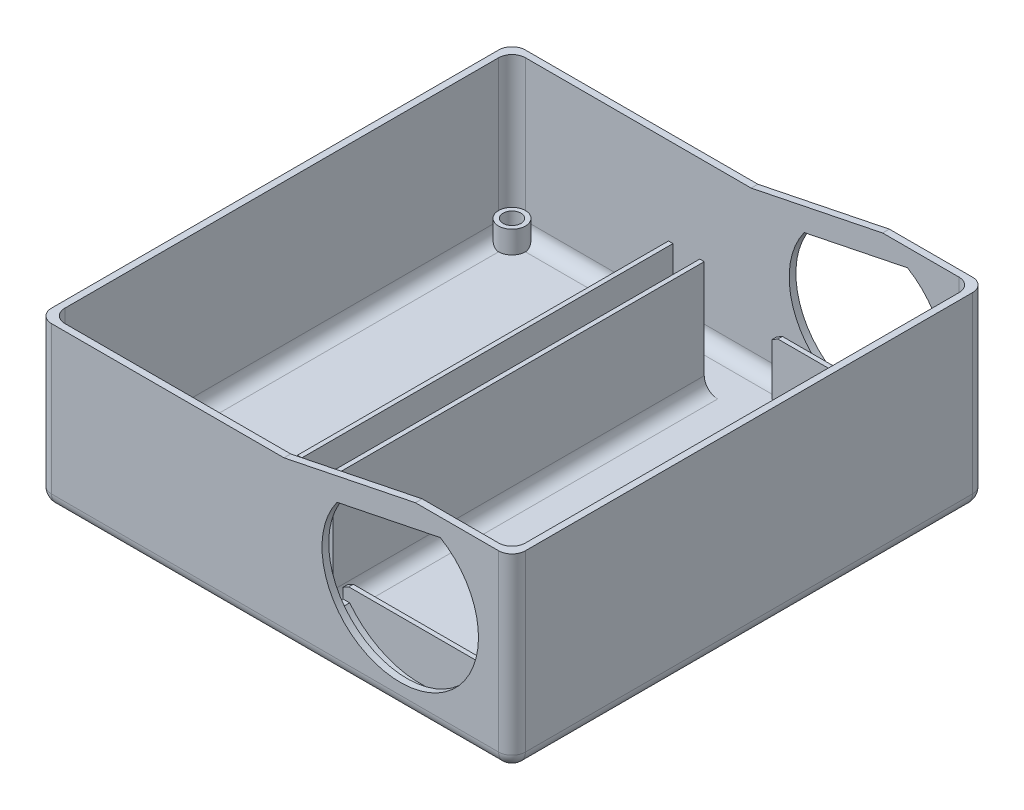
from build123d import *

# Parameters (mm, degrees)
EXTRUDE_1_DEPTH      = 42
SHELL_1_T            = -1.5
EXTRUDE_4_DEPTH      = 25
FILLET_2_R           = 3
CUT_EXTRUDE_3_DEPTH  = 126.73384588089242
CUT_EXTRUDE_4_DEPTH  = 126.73384588089242
EXTRUDE_5_DEPTH      = 4
CUT_EXTRUDE_7_DEPTH  = 3
CUT_EXTRUDE_START    = -0.1
CUT_EXTRUDE_12_DEPTH = 0.1
SKETCH_18_R          = 3.0000000000000018
SKETCH_18_R_2        = 2.0000000000000036
EXTRUDE_6_DEPTH      = 5
FILLET_3_R           = 3
SKETCH_22_W          = 3
SKETCH_22_H          = 3.000000000000014
CUT_EXTRUDE_13_DEPTH = 3
SKETCH_23_W          = 3.000000000000007
SKETCH_23_H          = 3.000000000000014
CUT_EXTRUDE_14_DEPTH = 3
FILLET_4_R           = 3


with BuildPart() as part:
    # 草图1 → 凸台-拉伸1 (new body)
    with BuildSketch(Plane(origin=(0, 0, 0), x_dir=(1, 0, 0), z_dir=(0, 1, 0))):
        Polygon((-53.000000000000014, 53), (52.999999999999986, 53), (53, -53), (-53, -53), align=None)
    extrude(amount=EXTRUDE_1_DEPTH)

    # 抽壳1
    shell_1_openings = [part.faces().sort_by_distance(p)[0] for p in [
        (0, 42, 0),
    ]]
    offset(amount=SHELL_1_T, openings=shell_1_openings, kind=Kind.INTERSECTION)

    # 草图3 → 凸台-拉伸4 (add)
    with BuildSketch(Plane(origin=(0, 1.5, 0), x_dir=(1, 0, 0), z_dir=(0, 1, 0))):
        Polygon((-6.500000000000012, 41.49999999999999), (-6.500000000000003, -41.49999999999999), (-5.500000000000003, -41.49999999999999), (-5.5000000000000036, 41.49999999999999), align=None)
        Polygon((1.4999999999999944, 41.49999999999999), (1.5000000000000053, -41.49999999999999), (0.5000000000000043, -41.49999999999999), (0.4999999999999944, 41.49999999999999), align=None)
    extrude(amount=EXTRUDE_4_DEPTH)

    # 圆角2
    fillet_2_edges = [part.edges().sort_by_distance(p)[0] for p in [
        (51.5, 21.75, 51.5),
        (51.499999999999986, 21.75, -51.5),
        (-51.500000000000014, 21.75, -51.5),
        (-51.5, 21.75, 51.5),
        (0, 0, 53),
        (-53.00000000000001, 0, 0),
        (-1.421e-14, 0, -53),
        (52.99999999999999, 0, 0),
        (53, 21, 53),
        (-53, 21, 53),
        (-53.000000000000014, 21, -53),
        (52.999999999999986, 21, -53),
    ]]
    fillet(fillet_2_edges, radius=FILLET_2_R)

    # 草图6 → 切除-拉伸3 (cut, through all)
    with BuildSketch(Plane.XY.offset(53)):
        Polygon((-53, 36.00000000000001), (2.0000000000000018, 36.00000000000001), (31.393876913398135, 42), (-53, 42), align=None)
    extrude(amount=-CUT_EXTRUDE_3_DEPTH, mode=Mode.SUBTRACT)

    # 草图7 → 切除-拉伸4 (cut, through all)
    with BuildSketch(Plane.XY.offset(53)):
        with BuildLine():
            Line((13.866100098640908, 33.319053909073325), (36.958961236370065, 38.032864449771985))
            ThreePointArc((36.958961236370065, 38.032864449771985), (31.499999999999993, 5.853571800517756), (13.866100098640908, 33.319053909073325))
        make_face()
    extrude(amount=-CUT_EXTRUDE_4_DEPTH, mode=Mode.SUBTRACT)

    # 草图8 → 凸台-拉伸5 (add)
    with BuildSketch(Plane(origin=(0, 0, 51.5), x_dir=(-1, 0, 0), z_dir=(0, 0, -1))):
        Polygon((-45.32050807568879, 13.00000000000003), (-44.021469970012134, 13.750000000000028), (-11.978530029987853, 13.750000000000032), (-10.679491924311197, 13.000000000000034), (-10.679491924311197, 1.5000000000000053), (-45.32050807568879, 1.5000000000000009), align=None)
    extrude_5 = extrude(amount=EXTRUDE_5_DEPTH)

    # 草图10 → 切除-拉伸7 (cut)
    with BuildSketch(Plane(origin=(0, 0, 51.5), x_dir=(-1, 0, 0), z_dir=(0, 0, -1))):
        with BuildLine():
            Line((-45.3205080756888, 13.000000000000043), (-27.999999999999996, 23))
            Line((-27.999999999999996, 23), (-10.679491924311197, 13.000000000000043))
            ThreePointArc((-10.679491924311197, 13.000000000000043), (-28, 2.9999999999999964), (-45.3205080756888, 13.000000000000043))
        make_face()
    cut_extrude_7 = extrude(amount=CUT_EXTRUDE_7_DEPTH, mode=Mode.SUBTRACT)

    # 镜向1: 凸台-拉伸5, 切除-拉伸7 across plane
    add(extrude_5.mirror(Plane.XY))
    add(cut_extrude_7.mirror(Plane.XY), mode=Mode.SUBTRACT)

    # 草图17 → 切除-拉伸12 (cut)
    with BuildSketch(Plane(origin=(0, 1.5, 0), x_dir=(1, 0, 0), z_dir=(0, 1, 0)).offset(CUT_EXTRUDE_START)):
        with BuildLine():
            Line((10.679491924311197, 47.5), (10.679491924311197, 51.5))
            Line((10.679491924311197, 51.5), (-48.50000000000001, 51.5))
            ThreePointArc((-48.50000000000001, 51.5), (-50.62132034355965, 50.62132034355964), (-51.500000000000014, 48.49999999999999))
            Line((-51.500000000000014, 48.49999999999999), (-51.5, -48.49999999999999))
            ThreePointArc((-51.5, -48.49999999999999), (-50.62132034355964, -50.62132034355964), (-48.49999999999999, -51.5))
            Line((-48.49999999999999, -51.5), (10.679491924311197, -51.5))
            Line((10.679491924311197, -51.5), (10.679491924311197, -47.5))
            Line((10.679491924311197, -47.5), (45.32050807568879, -47.5))
            Line((45.32050807568879, -47.5), (45.32050807568879, -51.5))
            Line((45.32050807568879, -51.5), (48.49999999999999, -51.5))
            ThreePointArc((48.49999999999999, -51.5), (50.62132034355964, -50.62132034355964), (51.5, -48.49999999999999))
            Line((51.5, -48.49999999999999), (51.499999999999986, 48.49999999999999))
            ThreePointArc((51.499999999999986, 48.49999999999999), (50.621320343559624, 50.62132034355964), (48.49999999999998, 51.5))
            Line((48.49999999999998, 51.5), (45.32050807568879, 51.5))
            Line((45.32050807568879, 51.5), (45.32050807568879, 47.5))
            Line((45.32050807568879, 47.5), (10.679491924311197, 47.5))
        make_face()
        Polygon((1.4999999999999944, 41.49999999999999), (0.4999999999999944, 41.49999999999999), (0.5000000000000043, -41.49999999999999), (1.5000000000000053, -41.49999999999999), align=None, mode=Mode.SUBTRACT)
        Polygon((-5.5000000000000036, 41.49999999999999), (-6.500000000000012, 41.49999999999999), (-6.500000000000003, -41.49999999999999), (-5.500000000000003, -41.49999999999999), align=None, mode=Mode.SUBTRACT)
    extrude(amount=CUT_EXTRUDE_12_DEPTH, mode=Mode.SUBTRACT)

    # 草图18 → 凸台-拉伸6 (add)
    # profile 1 of 2: a face of its own
    with BuildSketch(Plane(origin=(0, 1.4, 0), x_dir=(1, 0, 0), z_dir=(0, 1, 0))):
        with Locations((-48.50000000000001, 48.49999999999999)):
            Circle(SKETCH_18_R)
        with Locations(Location((-48.50000000000001, 48.49999999999999, 0), (0, 0, 270))):
            Circle(SKETCH_18_R_2, mode=Mode.SUBTRACT)
    # profile 2 of 2: a face of its own
    with BuildSketch(Plane(origin=(0, 1.4, 0), x_dir=(1, 0, 0), z_dir=(0, 1, 0))):
        with Locations((48.49999999999998, 48.49999999999999)):
            Circle(SKETCH_18_R)
        with Locations(Location((48.49999999999998, 48.49999999999999, 0), (0, 0, 270))):
            Circle(SKETCH_18_R_2, mode=Mode.SUBTRACT)
    extrude_6 = extrude(amount=EXTRUDE_6_DEPTH)

    # 镜向2: 凸台-拉伸6 across plane
    add(extrude_6.mirror(Plane.XY))

    # 圆角3
    fillet_3_edges = [part.edges().sort_by_distance(p)[0] for p in [
        (46.91025403784438, 1.4, -51.5),
        (51.49999999999999, 1.4, 0),
        (46.910254037844396, 1.4, 51.5),
        (-18.910254037844396, 1.4, 51.5),
        (-51.50000000000001, 1.4, 0),
        (-18.910254037844407, 1.4, -51.5),
    ]]
    fillet(fillet_3_edges, radius=FILLET_3_R)

    # 草图22 → 切除-拉伸13 (cut)
    with BuildSketch(Plane(origin=(1.49e-15, 13.750000000000034, 0), x_dir=(1, -1.1e-16, 0), z_dir=(1.1e-16, 1, 0))):
        with Locations((12.179491924311202, 50)):
            Rectangle(SKETCH_22_W, SKETCH_22_H)
    cut_extrude_13 = extrude(amount=-CUT_EXTRUDE_13_DEPTH, mode=Mode.SUBTRACT)

    # 草图23 → 切除-拉伸14 (cut)
    with BuildSketch(Plane(origin=(1.49e-15, 13.750000000000034, 0), x_dir=(1, -1.1e-16, 0), z_dir=(1.1e-16, 1, 0))):
        with Locations((43.82050807568879, 50)):
            Rectangle(SKETCH_23_W, SKETCH_23_H)
    cut_extrude_14 = extrude(amount=-CUT_EXTRUDE_14_DEPTH, mode=Mode.SUBTRACT)

    # 镜向3: 切除-拉伸13, 切除-拉伸14 across plane
    add(cut_extrude_13.mirror(Plane.XY), mode=Mode.SUBTRACT)
    add(cut_extrude_14.mirror(Plane.XY), mode=Mode.SUBTRACT)

    # 圆角4
    fillet_4_edges = [part.edges().sort_by_distance(p)[0] for p in [
        (-5.5000000000000036, 1.4, 0),
        (-6.500000000000008, 1.4, 0),
        (1.5, 1.4, 0),
        (0.49999999999999933, 1.4, 0),
    ]]
    fillet(fillet_4_edges, radius=FILLET_4_R - 0.0001)  # a hair under: the kernel refuses the full size


solid = part.part
